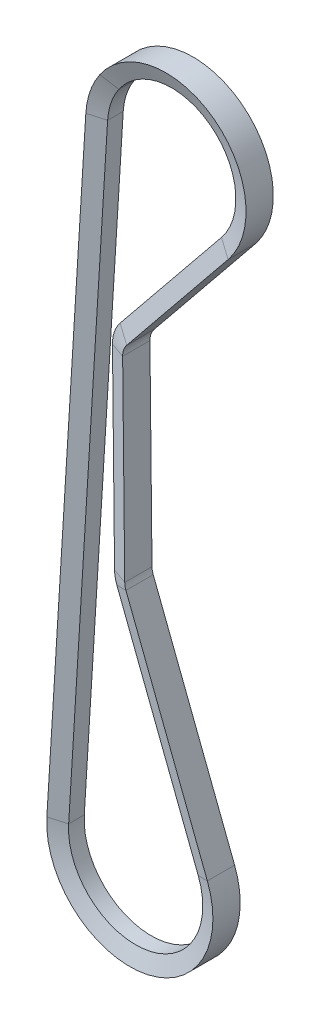
from build123d import *


with BuildPart() as part:
    # Sweep1: sweep along a path in Sketch2
    with BuildLine(Plane.XY) as sweep1_path:
        Line((-41.553151561, -217.844632112), (-27.94639351, 1.731788025))
        ThreePointArc((-27.94639351, 1.731788025), (10.173450161, 26.086412398), (21.740196898, -17.645504777))
        Line((21.740196898, -17.645504777), (-13.665248184, -61.266889206))
        ThreePointArc((-13.665248184, -61.266889206), (-14.730733379, -63.177640848), (-15.084518493, -65.336591203))
        Line((-15.084518493, -65.336591203), (-14.356826486, -133.332697447))
        ThreePointArc((-14.356826486, -133.332697447), (-14.243447455, -134.461236282), (-13.931105993, -135.551602054))
        Line((-13.931105993, -135.551602054), (14.494864769, -209.186714261))
        ThreePointArc((14.494864769, -209.186714261), (-8.151999526, -248.325225858), (-41.553151561, -217.844632112))
    # Sketch3 → Sweep1 (sweep)
    with BuildSketch(Plane(origin=(-23.060937427, 15.880590826, 0), x_dir=(0.8236049081193143, -0.5671639580595508, 0), z_dir=(0.5671639580595508, 0.8236049081193143, 0))):
        Polygon((0, 4.7625), (0, -4.7625), (5.588, -2.728634331), (5.588, 2.728634331), align=None)
    sweep(path=sweep1_path.line)


solid = part.part
